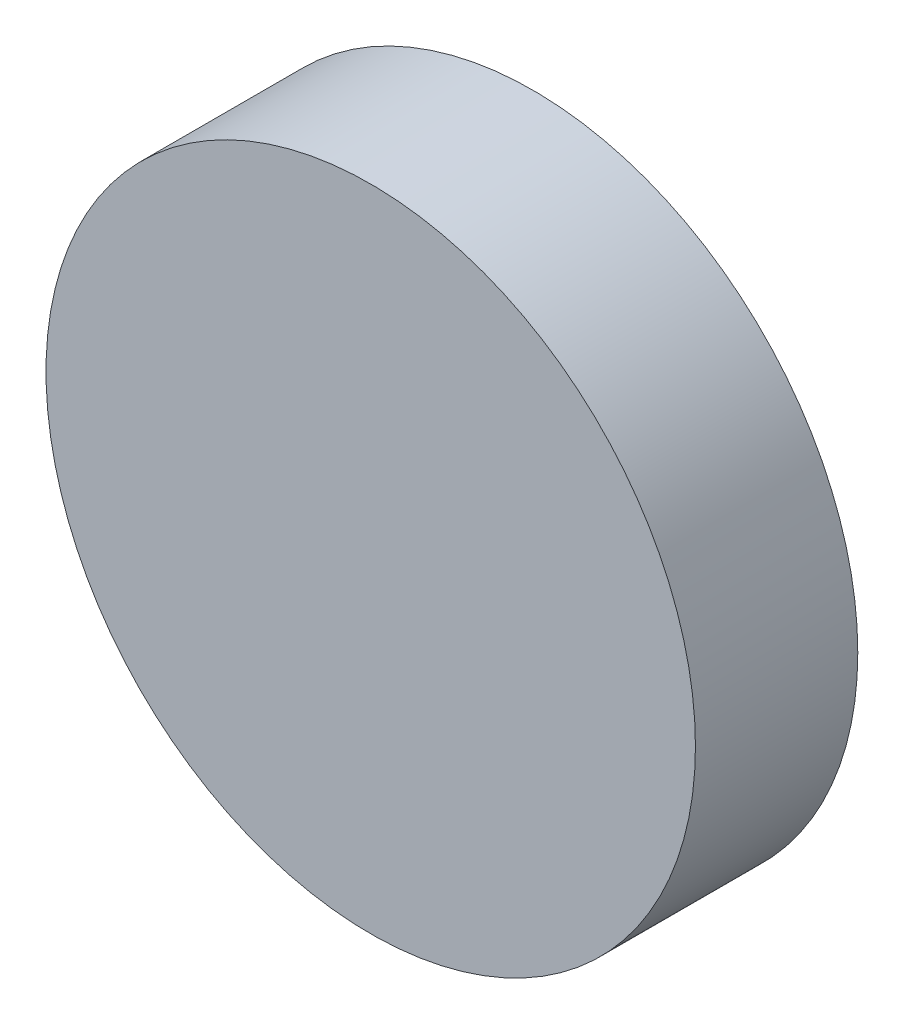
from build123d import *

# Parameters (mm, degrees)
SKETCH1_R           = 25.4
BOSS_EXTRUDE1_DEPTH = 12.7


with BuildPart() as part:
    # Sketch1 → Boss-Extrude1 (new body)
    with BuildSketch(Plane.XY):
        Circle(SKETCH1_R)
    extrude(amount=BOSS_EXTRUDE1_DEPTH)


solid = part.part
